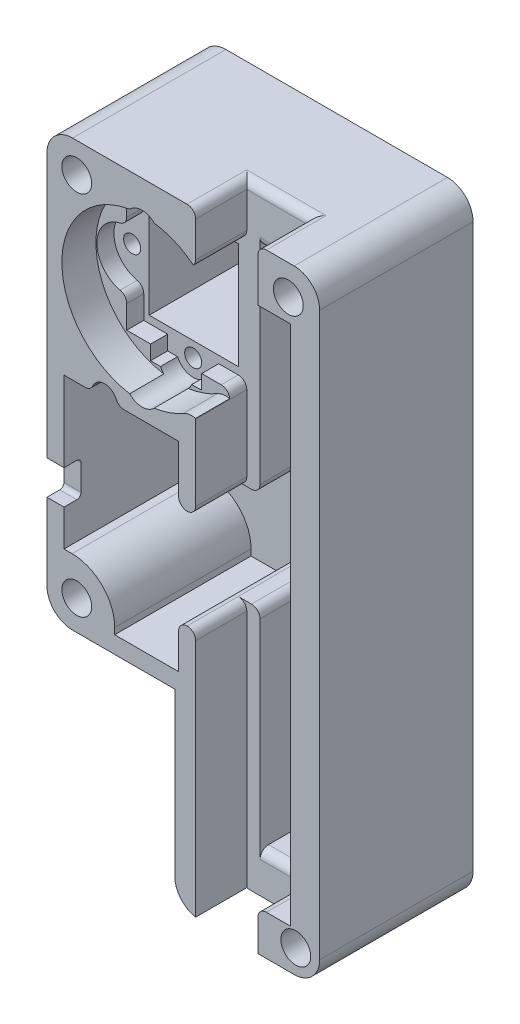
from build123d import *

# Parameters (mm, degrees)
BODY_SKETCH_W                        = 10.5
BODY_SKETCH_H                        = 12.5
BODY_DEPTH                           = 9
GEAR_BOX_R                           = 9.5
GEAR_PROFILE_DEPTH                   = 4
SCREWHOLE1_R                         = 1.75
SCREW1_DEPTH                         = 63.032249677
VERRUNDUNG2_R                        = 3
GLIDER_W                             = 9.6
GLIDER_H                             = 61.2
GLIDER_RUT_DEPTH                     = 16
VERRUNDUNG4_R                        = 2
HOLDER_OF_GLIDER_W                   = 4.5
HOLDER_OF_GLIDER_H                   = 8
GLIDER_HOLDER_DEPTH                  = 4.3
VERRUNDUNG5_R                        = 2
VERRUNDUNG6_R                        = 1
VERRUNDUNG7_R                        = 1
PINION_RUT_W                         = 4.5
PINION_RUT_H                         = 72
PINION_RUT_CUT_DEPTH                 = 5
VERRUNDUNG8_R                        = 2
SKETCH_PINION_CHANNEL_W              = 7.3
SKETCH_PINION_CHANNEL_H              = 75
PINION_CHANNEL_DEPTH                 = 6
VERRUNDUNG10_R                       = 1
VERRUNDUNG11_R                       = 1
MOTOR_HOLDER_DEPTH                   = 2
SKIZZE1_R                            = 1
MOTOR_SCREW_DEPTH                    = 10
SCHNITT_LINEAR_AUSTRAGEN2_DEPTH      = 61.991802728
SCHNITT_LINEAR_AUSTRAGEN2_DEPTH_BACK = 2
SKIZZE2_R                            = 2
SCHNITT_LINEAR_AUSTRAGEN3_DEPTH      = 2
VERRUNDUNG12_R                       = 1
VERRUNDUNG13_R                       = 1
LEFT_HOLE_R                          = 1
CENTER_HOLE_LEFT_DEPTH               = 10
ELECTRO_CAGE_DEPTH                   = 16
SKIZZE6_R                            = 1.5
SCHNITT_LINEAR_AUSTRAGEN5_DEPTH      = 18
SKIZZE7_R                            = 1.75
SCHNITT_LINEAR_AUSTRAGEN6_DEPTH      = 18
VERRUNDUNG14_R                       = 3
VERRUNDUNG15_R                       = 5
VERRUNDUNG16_R                       = 1
VERRUNDUNG17_R                       = 1
VERRUNDUNG18_R                       = 1
VERRUNDUNG19_R                       = 1
VERRUNDUNG20_R                       = 1
VERRUNDUNG21_R                       = 3
SKIZZE8_W                            = 2
SKIZZE8_H                            = 4
SCHNITT_LINEAR_AUSTRAGEN7_DEPTH      = 2
VERRUNDUNG22_R                       = 0.5


# Some blends are built 0.0001 mm under size
with BuildPart() as part:
    # body-sketch → body (new, symmetric)
    with BuildSketch(Plane.XY):
        Polygon((-32, 50), (0, 50), (0, -22), (-17, -22), (-17, 0), (-32, 0), align=None)
        with Locations((-20.75, 36.75)):
            Rectangle(BODY_SKETCH_W, BODY_SKETCH_H, mode=Mode.SUBTRACT)
    extrude(amount=BODY_DEPTH, both=True)

    # gear_box → gear_profile (cut)
    with BuildSketch(Plane.XY.offset(9)):
        with Locations((-20.75, 36.75)):
            Circle(GEAR_BOX_R)
    extrude(amount=-GEAR_PROFILE_DEPTH, mode=Mode.SUBTRACT)

    # screwhole1 → screw1 (cut, through all)
    with BuildSketch(Plane.XY.offset(9)):
        with Locations((-28.5, 46.5)):
            Circle(SCREWHOLE1_R)
        with Locations((-3.677178533, 46.5)):
            Circle(SCREWHOLE1_R)
        with Locations((-2.8, -19.2)):
            Circle(SCREWHOLE1_R)
    extrude(amount=-SCREW1_DEPTH, mode=Mode.SUBTRACT)

    # Verrundung2
    verrundung2_edges = [part.edges().sort_by_distance(p)[0] for p in [
        (-32, 50, 0),
        (0, 50, 0),
    ]]
    fillet(verrundung2_edges, radius=VERRUNDUNG2_R)

    # glider → glider_rut (cut)
    with BuildSketch(Plane.XY.offset(9)):
        with Locations((-8.2, 13.3)):
            Rectangle(GLIDER_W, GLIDER_H)
    extrude(amount=-GLIDER_RUT_DEPTH, mode=Mode.SUBTRACT)

    # Verrundung4
    verrundung4_edges = [part.edges().sort_by_distance(p)[0] for p in [
        (-13, 31.255684756, 7),
    ]]
    fillet(verrundung4_edges, radius=VERRUNDUNG4_R)

    # holder of glider → glider-holder (add)
    with BuildSketch(Plane.XY.offset(-7)):
        with Locations((-8.95, 26.8)):
            Rectangle(HOLDER_OF_GLIDER_W, HOLDER_OF_GLIDER_H)
        with Locations((-7.45, -1.3)):
            Rectangle(HOLDER_OF_GLIDER_W, HOLDER_OF_GLIDER_H)
    extrude(amount=GLIDER_HOLDER_DEPTH)

    # Verrundung5
    verrundung5_edges = [part.edges().sort_by_distance(p)[0] for p in [
        (-6.7, 22.8, -4.85),
        (-6.7, 30.8, -4.85),
        (-11.2, 30.8, -4.85),
        (-11.2, 22.8, -4.85),
        (-5.2, -5.3, -4.85),
        (-5.2, 2.7, -4.85),
        (-9.7, 2.7, -4.85),
        (-9.7, -5.3, -4.85),
    ]]
    fillet(verrundung5_edges, radius=VERRUNDUNG5_R)

    # Verrundung6
    verrundung6_edges = [part.edges().sort_by_distance(p)[0] for p in [
        (-11.2, 26.8, -7),
        (-8.95, 30.8, -7),
        (-6.7, 26.8, -7),
        (-8.95, 22.8, -7),
        (-10.614213562, 30.214213562, -7),
        (-7.285786438, 30.214213562, -7),
        (-7.285786438, 23.385786438, -7),
        (-10.614213562, 23.385786438, -7),
    ]]
    fillet(verrundung6_edges, radius=VERRUNDUNG6_R)

    # Verrundung7
    verrundung7_edges = [part.edges().sort_by_distance(p)[0] for p in [
        (-7.45, -5.3, -7),
        (-9.7, -1.3, -7),
        (-5.2, -1.3, -7),
        (-7.45, 2.7, -7),
        (-9.114213562, -4.714213562, -7),
        (-5.785786438, -4.714213562, -7),
        (-5.785786438, 2.114213562, -7),
        (-9.114213562, 2.114213562, -7),
    ]]
    fillet(verrundung7_edges, radius=VERRUNDUNG7_R)

    # Pinion rut → pinion rut cut (cut)
    with BuildSketch(Plane.XY.offset(9)):
        with Locations((-9.5, 14)):
            Rectangle(PINION_RUT_W, PINION_RUT_H)
    extrude(amount=-PINION_RUT_CUT_DEPTH, mode=Mode.SUBTRACT)

    # Verrundung8
    # the kernel refuses this fillet: 2 mm, written as the material it takes off along each edge
    with BuildSketch(Plane(origin=(-13, 42.244315244, 5), x_dir=(0, 1, 0), z_dir=(0, 0, 1))) as verrundung8_piece_1:
        with BuildLine():
            CenterArc((3.548666653, 0.645460718), VERRUNDUNG8_R, 141.845362101, 56.982763935)
            Line((1.975974149, 1.881032767), (1.944520299, 1.905744208))
            ThreePointArc((1.944520299, 1.905744208), (1.028281735, 0.89818793), (-0.023133959, 0.032631579))
            Line((-0.023133959, 0.032631579), (0, -0.04))
            ThreePointArc((0, -0.04), (0.827842378, -0.04), (1.617825118, -0.012909214))
            Line((1.617825118, -0.012909214), (1.655684756, 0))
        make_face()
    extrude(amount=10.820354696, mode=Mode.SUBTRACT)

    # sketch pinion channel → pinion channel (cut)
    with BuildSketch(Plane.XY.offset(9)):
        with Locations((-10.9, 12.5)):
            Rectangle(SKETCH_PINION_CHANNEL_W, SKETCH_PINION_CHANNEL_H)
    extrude(amount=-PINION_CHANNEL_DEPTH, mode=Mode.SUBTRACT)

    # Verrundung10
    verrundung10_edges = [part.edges().sort_by_distance(p)[0] for p in [
        (-7.25, -17.3, 6),
        (-7.25, 50, 6),
        (-14.55, 50, 6),
    ]]
    fillet(verrundung10_edges, radius=VERRUNDUNG10_R)

    # Verrundung11
    verrundung11_edges = [part.edges().sort_by_distance(p)[0] for p in [
        (-10.125, 43.9, 3),
        (-9.625, -17.3, 3),
        (-10.9, 50, 3),
    ]]
    fillet(verrundung11_edges, radius=VERRUNDUNG11_R)

    # motor-holder 2 → motor -holder (cut)
    with BuildSketch(Plane.XY.offset(5)):
        Polygon((-14.33941219, 43.85), (-14.33941219, 29.65), (-17.83941219, 29.65), (-17.83941219, 27.95), (-23.83941219, 27.95), (-23.83941219, 29.65), (-26.63941219, 29.65), (-26.63941219, 43.85), (-23.83941219, 43.85), (-23.83941219, 45.55), (-17.83941219, 45.55), (-17.83941219, 43.85), align=None)
    extrude(amount=-MOTOR_HOLDER_DEPTH, mode=Mode.SUBTRACT)

    # Skizze1 → motor-screw (cut)
    with BuildSketch(Plane.XY.offset(3)):
        with Locations((-20.83941219, 28.75)):
            Circle(SKIZZE1_R)
        with Locations((-20.83941219, 44.75)):
            Circle(SKIZZE1_R)
    extrude(amount=-MOTOR_SCREW_DEPTH, mode=Mode.SUBTRACT)

    # Skizze2 → Schnitt-Linear austragen2 (cut, two sides: drawn at the far end of the back side and taken through both)
    with BuildSketch(Plane.XY.offset(5).offset(-SCHNITT_LINEAR_AUSTRAGEN2_DEPTH_BACK)):
        with Locations((-20.83941219, 44.75)):
            Circle(SKIZZE2_R)
        with Locations((-20.83941219, 28.75)):
            Circle(SKIZZE2_R)
    extrude(amount=SCHNITT_LINEAR_AUSTRAGEN2_DEPTH + SCHNITT_LINEAR_AUSTRAGEN2_DEPTH_BACK, mode=Mode.SUBTRACT)

    # Skizze3 → Schnitt-Linear austragen3 (cut)
    with BuildSketch(Plane.XY.offset(5)):
        with BuildLine():
            Line((-26.63941219, 40.25), (-26.63941219, 33.25))
            ThreePointArc((-26.63941219, 33.25), (-30.13941219, 36.75), (-26.63941219, 40.25))
        make_face()
    extrude(amount=-SCHNITT_LINEAR_AUSTRAGEN3_DEPTH, mode=Mode.SUBTRACT)

    # Verrundung12
    verrundung12_edges = [part.edges().sort_by_distance(p)[0] for p in [
        (-14.55, 29.65, 4),
        (-14.55, 43.85, 4),
    ]]
    fillet(verrundung12_edges, radius=VERRUNDUNG12_R)

    # Verrundung13
    verrundung13_edges = [part.edges().sort_by_distance(p)[0] for p in [
        (-26.63941219, 33.25, 4),
        (-26.63941219, 40.25, 4),
    ]]
    fillet(verrundung13_edges, radius=VERRUNDUNG13_R)

    # left hole → center-hole-left (cut)
    with BuildSketch(Plane.XY.offset(3)):
        with Locations((-28, 36.75)):
            Circle(LEFT_HOLE_R)
    extrude(amount=-CENTER_HOLE_LEFT_DEPTH, mode=Mode.SUBTRACT)

    # cage → electro-cage (cut)
    with BuildSketch(Plane.XY.offset(9)):
        Polygon((-30, 25.412090366), (-30, 7.737950254), (-24.052522804, 7.737950254), (-24.052522804, 2), (-16.55, 2), (-16.55, 7.140007769), (-7.441971484, 7.140007769), (-7.441971484, 18.806564473), (-16.55, 18.806564473), (-16.55, 25.412090366), align=None)
    extrude(amount=-ELECTRO_CAGE_DEPTH, mode=Mode.SUBTRACT)

    # Skizze6 → Schnitt-Linear austragen5 (cut)
    with BuildSketch(Plane.XY.offset(9)):
        with Locations((-25.237300627, 25.412090366)):
            Circle(SKIZZE6_R)
    extrude(amount=-SCHNITT_LINEAR_AUSTRAGEN5_DEPTH, mode=Mode.SUBTRACT)

    # Skizze7 → Schnitt-Linear austragen6 (cut)
    with BuildSketch(Plane.XY.offset(9)):
        with Locations((-28.5, 3.5)):
            Circle(SKIZZE7_R)
    extrude(amount=-SCHNITT_LINEAR_AUSTRAGEN6_DEPTH, mode=Mode.SUBTRACT)

    # Verrundung14
    verrundung14_edges = [part.edges().sort_by_distance(p)[0] for p in [
        (-32, 0, 0),
    ]]
    fillet(verrundung14_edges, radius=VERRUNDUNG14_R)

    # Verrundung15
    verrundung15_edges = [part.edges().sort_by_distance(p)[0] for p in [
        (-24.052522804, 7.737950254, 1),
    ]]
    fillet(verrundung15_edges, radius=VERRUNDUNG15_R)

    # Verrundung16
    verrundung16_edges = [part.edges().sort_by_distance(p)[0] for p in [
        (-16.55, 18.806564473, 1),
    ]]
    fillet(verrundung16_edges, radius=VERRUNDUNG16_R)

    # Verrundung17
    verrundung17_edges = [part.edges().sort_by_distance(p)[0] for p in [
        (-16.55, 7.140007769, 1),
    ]]
    fillet(verrundung17_edges, radius=VERRUNDUNG17_R)

    # Verrundung18
    # the kernel refuses this fillet: 1 mm, written as the material it takes off along each edge
    with BuildSketch(Plane(origin=(-23.737300627, 25.412090366, 10.978219619), x_dir=(-0.20430964368921942, 0.9789063129307034, 0), z_dir=(0, 0, -1))) as verrundung18_piece_1:
        with BuildLine():
            CenterArc((0.817238575, 0.978906313), VERRUNDUNG18_R, 191.789089239, 66.421821522)
            Line((-0.161667738, 0.774596669), (0, 0))
            ThreePointArc((0, 0), (0.306464466, 0.031640531), (0.612928931, 0))
        make_face()
    extrude(amount=17.978219619, mode=Mode.SUBTRACT)

    # Verrundung19
    verrundung19_edges = [part.edges().sort_by_distance(p)[0] for p in [
        (-13, 18.806564473, -2),
        (-13, 7.140007769, -2),
        (-14.55, 7.140007769, 6),
        (-14.55, 18.806564473, 6),
    ]]
    fillet(verrundung19_edges, radius=VERRUNDUNG19_R - 0.0001)  # a hair under: the kernel refuses the full size

    # Verrundung20
    verrundung20_edges = [part.edges().sort_by_distance(p)[0] for p in [
        (-26.737300627, 25.412090366, 1),
    ]]
    fillet(verrundung20_edges, radius=VERRUNDUNG20_R)

    # Verrundung21
    verrundung21_edges = [part.edges().sort_by_distance(p)[0] for p in [
        (-17, -22, 0),
        (0, -22, 0),
    ]]
    fillet(verrundung21_edges, radius=VERRUNDUNG21_R)

    # Skizze8 → Schnitt-Linear austragen7 (cut)
    with BuildSketch(Plane.XY.offset(9)):
        with Locations((-31, 14)):
            Rectangle(SKIZZE8_W, SKIZZE8_H)
    extrude(amount=-SCHNITT_LINEAR_AUSTRAGEN7_DEPTH, mode=Mode.SUBTRACT)

    # Verrundung22
    verrundung22_edges = [part.edges().sort_by_distance(p)[0] for p in [
        (-31, 16, 7),
        (-31, 12, 7),
    ]]
    fillet(verrundung22_edges, radius=VERRUNDUNG22_R)


solid = part.part
